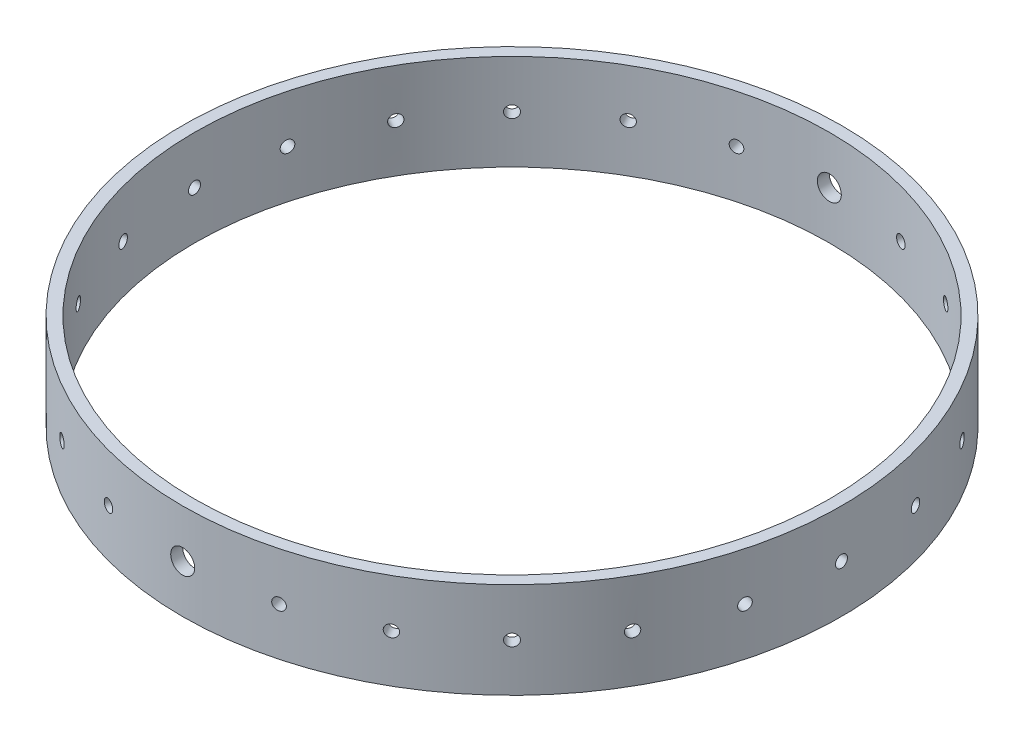
from build123d import *

# Parameters (mm, degrees)
SKETCH1_R               = 87.3125
SKETCH1_R_2             = 84.1375
BOSS_EXTRUDE1_DEPTH     = 25.4
CUT_EXTRUDE1_REACH      = 198.882
SKETCH2_R               = 1.5875
CIRPATTERN1_COUNT       = 24
CUT_EXTRUDE2_DEPTH      = 197.882003601
CUT_EXTRUDE2_DEPTH_BACK = 197.882003601
SKETCH3_R               = 3.175


with BuildPart() as part:
    # Sketch1 → Boss-Extrude1 (new body)
    with BuildSketch(Plane(origin=(0, 0, 0), x_dir=(1, 0, 0), z_dir=(0, 1, 0))):
        Circle(SKETCH1_R)
        Circle(SKETCH1_R_2, mode=Mode.SUBTRACT)
    extrude(amount=BOSS_EXTRUDE1_DEPTH)

    # Sketch2 → Cut-Extrude1 (cut, up to next)
    with BuildSketch(Plane.XY.offset(87.3125), mode=Mode.PRIVATE) as cut_extrude1_sk1:
        with Locations((0, 12.7)):
            Circle(SKETCH2_R)
    cut_extrude1_tool1 = extrude(cut_extrude1_sk1.sketch, amount=-CUT_EXTRUDE1_REACH, mode=Mode.PRIVATE) & part.part
    cut_extrude1 = cut_extrude1_tool1.solids().sort_by_distance((0, 12.7, 87.3125))[0]
    add(cut_extrude1, mode=Mode.SUBTRACT)

    # CirPattern1: Cut-Extrude1 ×24 about axis
    cirpattern1_axis = Axis((0, 25.4, 0), (0, -1, 0))
    for i in range(1, CIRPATTERN1_COUNT):
        add(cut_extrude1.rotate(cirpattern1_axis, i * 360 / CIRPATTERN1_COUNT), mode=Mode.SUBTRACT)

    # Sketch3 → Cut-Extrude2 (cut, two sides: drawn at the far end of the back side and taken through both)
    with BuildSketch(Plane.XY.offset(87.3125).offset(-CUT_EXTRUDE2_DEPTH_BACK)):
        with Locations((0, 12.7)):
            Circle(SKETCH3_R)
    extrude(amount=CUT_EXTRUDE2_DEPTH + CUT_EXTRUDE2_DEPTH_BACK, mode=Mode.SUBTRACT)


solid = part.part
